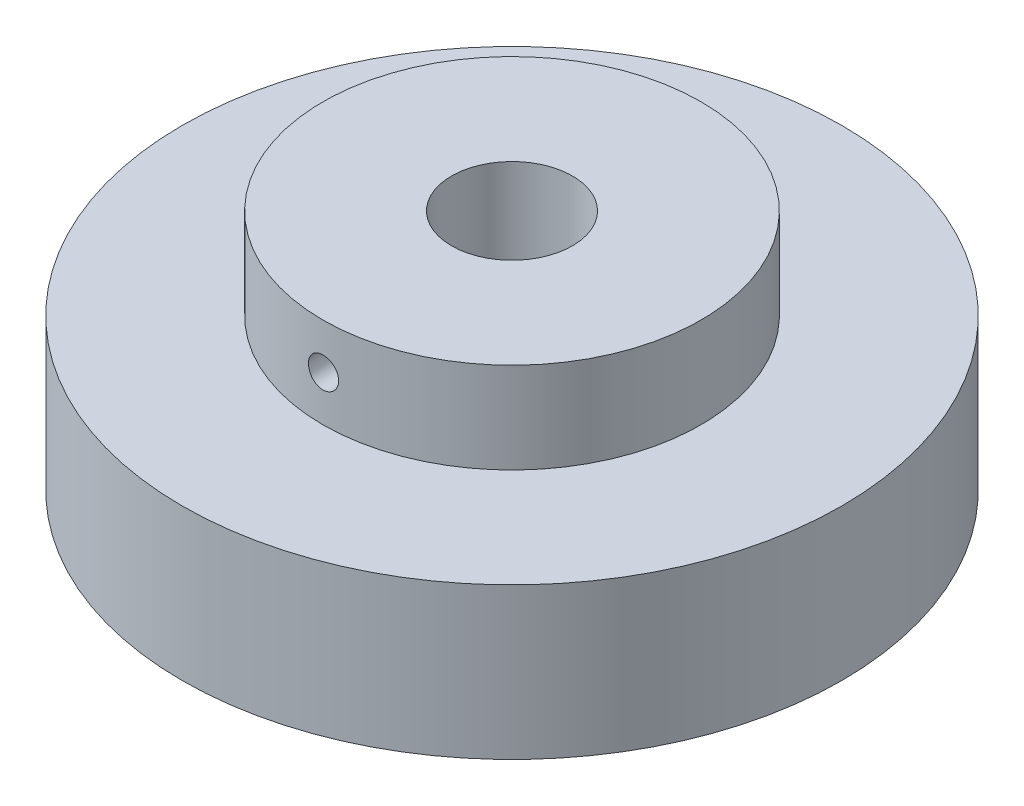
from build123d import *

# Parameters (mm, degrees)
SKETCH_1_R          = 21.8
SKETCH_1_R_2        = 4
EXTRUDE_1_DEPTH     = 10
SKETCH_2_R          = 12.5
SKETCH_2_R_2        = 4
EXTRUDE_2_DEPTH     = 6
CUT_EXTRUDE_1_REACH = 36.734
SKETCH_3_R          = 1


with BuildPart() as part:
    # 草圖1 → 填料-伸長1 (new body)
    with BuildSketch(Plane(origin=(0, 0, 0), x_dir=(1, 0, 0), z_dir=(0, 1, 0))):
        Circle(SKETCH_1_R)
        Circle(SKETCH_1_R_2, mode=Mode.SUBTRACT)
    extrude(amount=EXTRUDE_1_DEPTH)

    # 草圖2 → 填料-伸長2 (add)
    with BuildSketch(Plane(origin=(0, 10, 0), x_dir=(1, 0, 0), z_dir=(0, 1, 0))):
        Circle(SKETCH_2_R)
        Circle(SKETCH_2_R_2, mode=Mode.SUBTRACT)
    extrude(amount=EXTRUDE_2_DEPTH)

    # 草圖3 → 除料-伸長1 (cut, up to next)
    with BuildSketch(Plane.XY, mode=Mode.PRIVATE) as cut_extrude_1_sk1:
        with Locations((0, 13)):
            Circle(SKETCH_3_R)
    cut_extrude_1_tool1 = extrude(cut_extrude_1_sk1.sketch, amount=CUT_EXTRUDE_1_REACH, mode=Mode.PRIVATE) & part.part
    add(cut_extrude_1_tool1.solids().sort_by_distance((0, 13, 0))[0], mode=Mode.SUBTRACT)


solid = part.part
